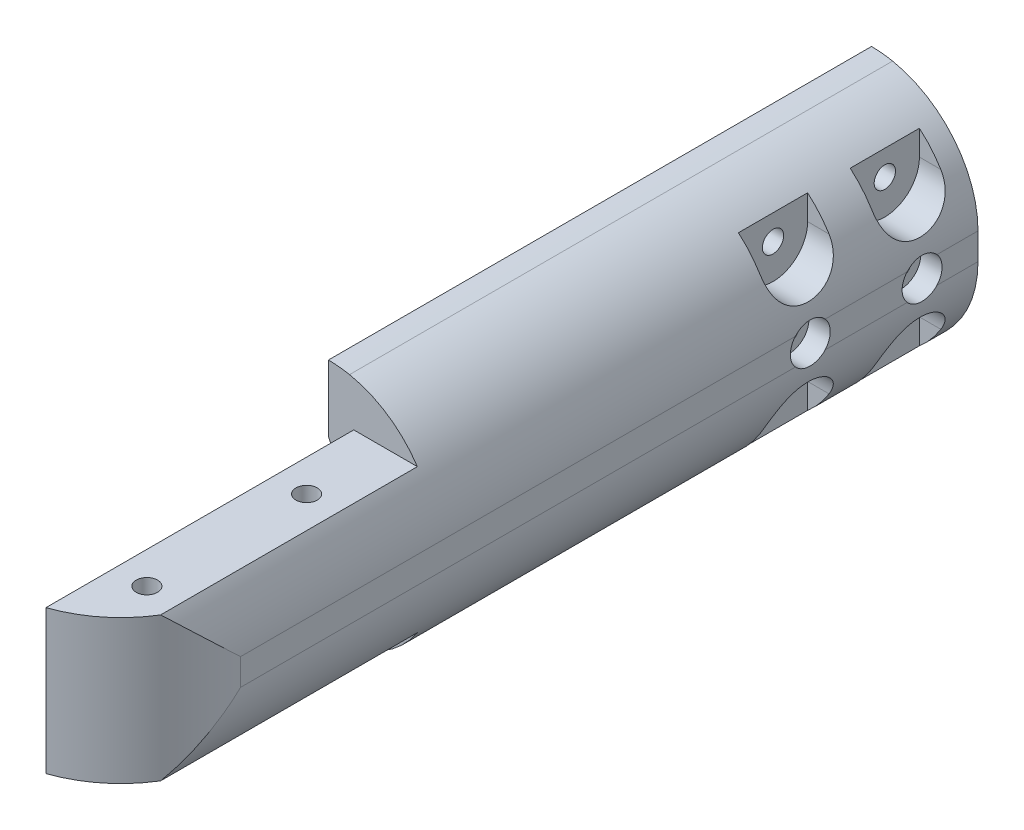
from build123d import *

# Parameters (mm, degrees)
BOSS_EXTRUDE1_DEPTH = 40
BOSS_EXTRUDE4_DEPTH = 62
BOSS_EXTRUDE5_DEPTH = 59
SKETCH6_R           = 2
CUT_EXTRUDE1_DEPTH  = 167.502702677
CUT_EXTRUDE3_DEPTH  = 165.114099029
CUT_EXTRUDE2_DEPTH  = 167.213605035
SKETCH9_R           = 2
CUT_EXTRUDE4_DEPTH  = 163.610604759
SKETCH10_R          = 3.75
CUT_EXTRUDE5_DEPTH  = 4
CUT_EXTRUDE6_DEPTH  = 7


with BuildPart() as part:
    # Sketch1 → Boss-Extrude1 (new body)
    with BuildSketch(Plane.XY):
        with BuildLine():
            ThreePointArc((0.25, -22.498611068), (22.5, 0), (0.25, 22.498611068))
            Line((0.25, 22.498611068), (0.25, 9.996874512))
            ThreePointArc((0.25, 9.996874512), (10, 0), (0.25, -9.996874512))
            Line((0.25, -9.996874512), (0.25, -22.498611068))
        make_face()
    extrude(amount=BOSS_EXTRUDE1_DEPTH)

    # Sketch5 → Boss-Extrude4 (add)
    with BuildSketch(Plane.XY.offset(40)):
        with BuildLine():
            Line((0.25, -9.996874512), (0.25, -22.498611068))
            ThreePointArc((0.25, -22.498611068), (22.5, 0), (0.25, 22.498611068))
            Line((0.25, 22.498611068), (0.25, 9.996874512))
            ThreePointArc((0.25, 9.996874512), (3.00746435, 0), (0.25, -9.996874512))
        make_face()
    extrude(amount=BOSS_EXTRUDE4_DEPTH)

    # Sketch3 → Boss-Extrude5 (add)
    with BuildSketch(Plane.XY.offset(102)):
        with BuildLine():
            ThreePointArc((18, -13.5), (22.5, 0), (18, 13.5))
            Line((18, 13.5), (5, 13.5))
            Line((5, 13.5), (5, -13.5))
            Line((5, -13.5), (18, -13.5))
        make_face()
    extrude(amount=BOSS_EXTRUDE5_DEPTH)

    # Sketch6 → Cut-Extrude1 (cut, through all)
    with BuildSketch(Plane.XZ.offset(13.5)):
        with Locations((10.995, 116.85)):
            Circle(SKETCH6_R)
        with Locations((10.995, 146.85)):
            Circle(SKETCH6_R)
    extrude(amount=-CUT_EXTRUDE1_DEPTH, mode=Mode.SUBTRACT)

    # Sketch8 → Cut-Extrude3 (cut, through all)
    with BuildSketch(Plane(origin=(0, 0, 0), x_dir=(-1, 0, 0), z_dir=(0, 0, -1))):
        with BuildLine():
            Line((-20.25, -2.498611068), (-20.25, 2.498611068))
            ThreePointArc((-20.25, 2.498611068), (-15.729842997, 15.162514921), (-4.21255392, 22.102135405))
            ThreePointArc((-4.21255392, 22.102135405), (-22.5, 0), (-4.21255392, -22.102135405))
            ThreePointArc((-4.21255392, -22.102135405), (-15.729842997, -15.162514921), (-20.25, -2.498611068))
        make_face()
    extrude(amount=-CUT_EXTRUDE3_DEPTH, mode=Mode.SUBTRACT)

    # Sketch7 → Cut-Extrude2 (cut, through all)
    with BuildSketch(Plane.XZ.offset(13.5)):
        with BuildLine():
            Line((20.25, 138.5), (20.25, 161))
            Line((20.25, 161), (-2.25, 161))
            ThreePointArc((-2.25, 161), (13.659902577, 154.409902577), (20.25, 138.5))
        make_face()
    extrude(amount=-CUT_EXTRUDE2_DEPTH, mode=Mode.SUBTRACT)

    # Sketch9 → Cut-Extrude4 (cut, through all)
    with BuildSketch(Plane.ZY.offset(-0.25)):
        with Locations((31.5, -13)):
            Circle(SKETCH9_R)
        with Locations((10.5, -13)):
            Circle(SKETCH9_R)
        with Locations((10.5, 13)):
            Circle(SKETCH9_R)
        with Locations((31.5, 13)):
            Circle(SKETCH9_R)
        with Locations((31.5, 0)):
            Circle(SKETCH9_R)
        with Locations((10.5, 0)):
            Circle(SKETCH9_R)
    extrude(amount=-CUT_EXTRUDE4_DEPTH, mode=Mode.SUBTRACT)

    # Sketch10 → Cut-Extrude5 (cut)
    with BuildSketch(Plane(origin=(20.25, 0, 0), x_dir=(0, 0, -1), z_dir=(1, 0, 0))):
        with Locations((-31.5, 0)):
            Circle(SKETCH10_R)
        with Locations((-10.5, 0)):
            Circle(SKETCH10_R)
    extrude(amount=-CUT_EXTRUDE5_DEPTH, mode=Mode.SUBTRACT)

    # Sketch11 → Cut-Extrude6 (cut)
    with BuildSketch(Plane(origin=(20.25, 0, 0), x_dir=(0, 0, -1), z_dir=(1, 0, 0))):
        with BuildLine():
            Line((-4, -13), (-4, -19.5))
            Line((-4, -19.5), (-17, -19.5))
            Line((-17, -19.5), (-17, -13))
            ThreePointArc((-17, -13), (-10.5, -6.5), (-4, -13))
        make_face()
        with BuildLine():
            Line((-25, -13), (-25, -19.5))
            Line((-25, -19.5), (-38, -19.5))
            Line((-38, -19.5), (-38, -13))
            ThreePointArc((-38, -13), (-31.5, -6.5), (-25, -13))
        make_face()
        with BuildLine():
            Line((-38, 19.5), (-38, 13))
            ThreePointArc((-38, 13), (-31.5, 6.5), (-25, 13))
            Line((-25, 13), (-25, 19.5))
            Line((-25, 19.5), (-38, 19.5))
        make_face()
        with BuildLine():
            Line((-17, 19.5), (-17, 13))
            ThreePointArc((-17, 13), (-10.5, 6.5), (-4, 13))
            Line((-4, 13), (-4, 19.5))
            Line((-4, 19.5), (-17, 19.5))
        make_face()
    extrude(amount=-CUT_EXTRUDE6_DEPTH, mode=Mode.SUBTRACT)


solid = part.part
